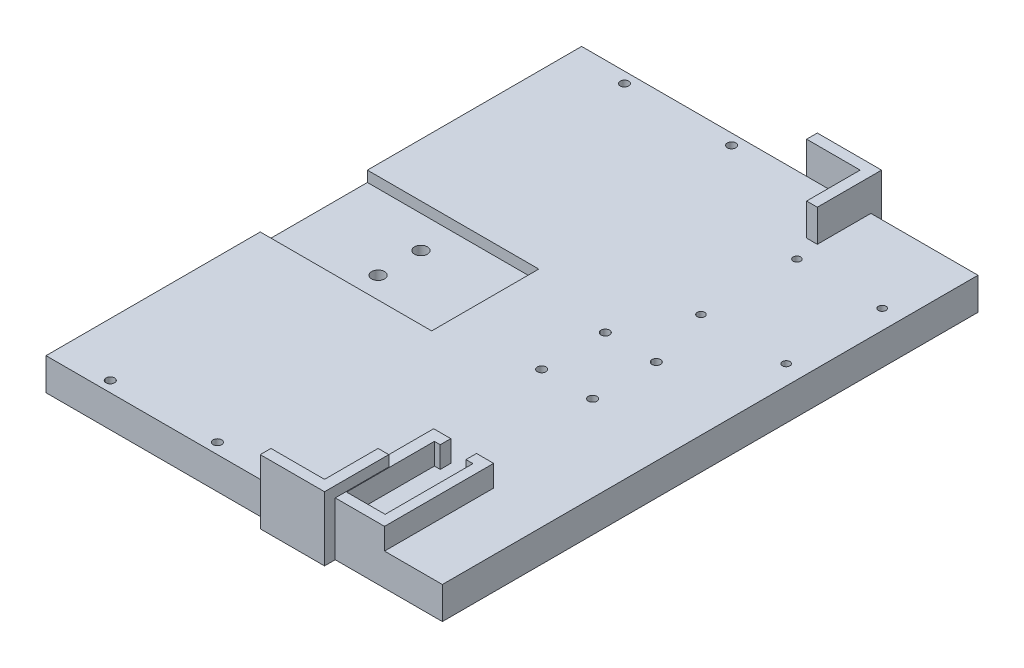
from build123d import *
from OCP.BRepFilletAPI import BRepFilletAPI_MakeChamfer

# Parameters (mm, degrees)
AUFSATZ_LINEAR_AUSTRAGEN1_DEPTH      = 15
SKIZZE2_W                            = 5
SKIZZE2_H                            = 4
SKIZZE2_H_2                          = 3
AUFSATZ_LINEAR_AUSTRAGEN2_DEPTH      = 37
AUFSATZ_LINEAR_AUSTRAGEN3_DEPTH      = 15
SKIZZE4_W                            = 5
SKIZZE4_H                            = 250
AUFSATZ_LINEAR_AUSTRAGEN4_DEPTH      = 15
SKIZZE5_W                            = 30
SKIZZE5_H                            = 5
AUFSATZ_LINEAR_AUSTRAGEN5_DEPTH      = 30
AUFSATZ_LINEAR_AUSTRAGEN6_DEPTH      = 15
AUFSATZ_LINEAR_AUSTRAGEN6_2_DEPTH    = 15
SKIZZE7_W                            = 5
SKIZZE7_H                            = 5
AUFSATZ_LINEAR_AUSTRAGEN7_DEPTH      = 15
AUFSATZ_LINEAR_AUSTRAGEN8_DEPTH      = 15
AUFSATZ_LINEAR_AUSTRAGEN8_DEPTH_BACK = 15
SKIZZE8_W                            = 5
SKIZZE8_H                            = 30.74644599
SKIZZE8_H_2                          = 29.008771532
SKIZZE9_W                            = 5
SKIZZE9_H                            = 5
AUFSATZ_LINEAR_AUSTRAGEN10_DEPTH     = 15
SKIZZE10_W                           = 5
SKIZZE10_H                           = 30
SCHNITT_LINEAR_AUSTRAGEN1_DEPTH      = 1.01
SKIZZE12_W                           = 10.711230156
SKIZZE12_H                           = 5
SKIZZE12_W_2                         = 5
SKIZZE12_H_2                         = 5.74644599
SKIZZE12_H_3                         = 4.008771532
SKIZZE12_W_3                         = 18.406645612
SKIZZE12_H_4                         = 11.130363441
SKIZZE12_W_4                         = 9.588104439
SKIZZE12_H_5                         = 13.193622238
SCHNITT_LINEAR_AUSTRAGEN2_DEPTH      = 15
SKIZZE13_W                           = 10.711230156
SKIZZE13_H                           = 5
SKIZZE13_W_2                         = 9.588104439
SKIZZE13_W_3                         = 5
SKIZZE13_H_2                         = 13.193622238
SKIZZE13_H_3                         = 11.130363441
SKIZZE13_W_4                         = 18.406645612
SCHNITT_LINEAR_AUSTRAGEN3_DEPTH      = 15
SKIZZE14_W                           = 50
SKIZZE14_H                           = 50
SKIZZE14_W_2                         = 20
AUFSATZ_LINEAR_AUSTRAGEN11_DEPTH     = 20
FASE2_SIZE                           = 20
FASE2_SIZE2                          = 50
FASE3_SIZE                           = 20
FASE3_SIZE2                          = 35
FASE4_SIZE                           = 20
SKIZZE15_R                           = 10
SKIZZE15_R_2                         = 7.5
AUFSATZ_LINEAR_AUSTRAGEN12_DEPTH     = 3
VERRUNDUNG1_R                        = 10
SKIZZE18_R                           = 10
SKIZZE18_R_2                         = 7.5
AUFSATZ_LINEAR_AUSTRAGEN13_DEPTH     = 3
VERRUNDUNG2_R                        = 10
SKIZZE19_R                           = 10
AUFSATZ_LINEAR_AUSTRAGEN14_DEPTH     = 3
VERRUNDUNG3_R                        = 10
SKIZZE20_R                           = 1.5
SCHNITT_LINEAR_AUSTRAGEN4_DEPTH      = 250
SKIZZE21_W                           = 4
SKIZZE21_H                           = 7
SKIZZE21_H_2                         = 5.2
SKIZZE21_W_2                         = 41
AUFSATZ_LINEAR_AUSTRAGEN15_DEPTH     = 10
SKIZZE22_R                           = 1.75
SCHNITT_LINEAR_AUSTRAGEN5_DEPTH      = 20
SCHNITT_LINEAR_AUSTRAGEN6_DEPTH      = 59
SCHNITT_LINEAR_AUSTRAGEN6_DEPTH_BACK = 47
SKIZZE23_W                           = 190
SKIZZE23_H                           = 302.641157469
SKIZZE24_W                           = 50
SKIZZE24_H                           = 5
SCHNITT_LINEAR_AUSTRAGEN7_DEPTH      = 80
SKIZZE25_R                           = 12.5
SCHNITT_LINEAR_AUSTRAGEN8_DEPTH      = 80
SKIZZE26_R                           = 17.590862423
AUFSATZ_LINEAR_AUSTRAGEN16_DEPTH     = 10
SKIZZE27_R                           = 3
SCHNITT_LINEAR_AUSTRAGEN10_DEPTH     = 93
SKIZZE28_R                           = 2
SCHNITT_LINEAR_AUSTRAGEN11_DEPTH     = 93
SKIZZE29_R                           = 2
SCHNITT_LINEAR_AUSTRAGEN13_DEPTH     = 20
SKIZZE30_W                           = 80
SKIZZE30_H                           = 50
AUFSATZ_LINEAR_AUSTRAGEN17_DEPTH     = 7
SKIZZE31_R                           = 3
SCHNITT_LINEAR_AUSTRAGEN14_DEPTH     = 27
AUFSATZ_LINEAR_START                 = -9
SKIZZE32_R                           = 3
SKIZZE32_R_2                         = 3.723627145
SKIZZE32_R_3                         = 5.253378479
SKIZZE32_R_4                         = 5.58705402
AUFSATZ_LINEAR_AUSTRAGEN18_DEPTH     = 9
SKIZZE35_R                           = 1.75
SCHNITT_LINEAR_AUSTRAGEN16_DEPTH     = 20
SKIZZE36_R                           = 6.846616126
SKIZZE36_R_2                         = 4.471320942
SKIZZE36_R_3                         = 4.89424988
SKIZZE36_R_4                         = 3.525123697
AUFSATZ_LINEAR_AUSTRAGEN19_DEPTH     = 15
SKIZZE39_W                           = 50
SKIZZE39_H                           = 250
SCHNITT_LINEAR_AUSTRAGEN17_DEPTH     = 57
SKIZZE40_W                           = 11.456450468
SKIZZE40_H                           = 117.894868185
SCHNITT_LINEAR_AUSTRAGEN18_DEPTH     = 86
SKIZZE41_W                           = 5.359084078
SKIZZE41_H                           = 0.710531035
SCHNITT_LINEAR_AUSTRAGEN19_DEPTH     = 69
AUFSATZ_LINEAR_AUSTRAGEN20_DEPTH     = 10


with BuildPart() as part:
    # Skizze1 → Aufsatz-Linear austragen1 (new body)
    with BuildSketch(Plane(origin=(0, 0, 0), x_dir=(1, 0, 0), z_dir=(0, 1, 0))):
        Polygon((-105, 65), (-175, 65), (-175, -65), (-105, -65), (-105, -125), (145, -125), (185, -20), (175, -20), (175, 0), (175, 20), (185, 20), (145, 125), (-105, 125), align=None)
        Polygon((175, 0), (175, 20), (185, 20), (185, 0), (185, -20), (175, -20), align=None)
    extrude(amount=AUFSATZ_LINEAR_AUSTRAGEN1_DEPTH)

    # Skizze2 → Aufsatz-Linear austragen2 (add)
    with BuildSketch(Plane(origin=(0, 15, 0), x_dir=(1, 0, 0), z_dir=(0, 1, 0))):
        with Locations((-122.5, -40)):
            Rectangle(SKIZZE2_W, SKIZZE2_H)
        with Locations((-122.5, 40)):
            Rectangle(SKIZZE2_W, SKIZZE2_H)
        with Locations((-122.5, 63.5)):
            Rectangle(SKIZZE2_W, SKIZZE2_H_2)
        with Locations((-122.5, -63.5)):
            Rectangle(SKIZZE2_W, SKIZZE2_H_2)
    extrude(amount=-AUFSATZ_LINEAR_AUSTRAGEN2_DEPTH)

    # Skizze3 → Aufsatz-Linear austragen3 (add)
    with BuildSketch(Plane(origin=(0, 15, 0), x_dir=(1, 0, 0), z_dir=(0, 1, 0))):
        Polygon((145, -125), (195, -125), (195, 125), (145, 125), (185, 20), (185, -20), align=None)
    extrude(amount=-AUFSATZ_LINEAR_AUSTRAGEN3_DEPTH)

    # Skizze4 → Aufsatz-Linear austragen4 (add)
    with BuildSketch(Plane(origin=(0, 15, 0), x_dir=(1, 0, 0), z_dir=(0, 1, 0))):
        with Locations((197.5, 0)):
            Rectangle(SKIZZE4_W, SKIZZE4_H)
    extrude(amount=-AUFSATZ_LINEAR_AUSTRAGEN4_DEPTH)

    # Skizze5 → Aufsatz-Linear austragen5 (add)
    with BuildSketch(Plane(origin=(0, 15, 0), x_dir=(1, 0, 0), z_dir=(0, 1, 0))):
        with Locations((-90, 122.5)):
            Rectangle(SKIZZE5_W, SKIZZE5_H)
        with Locations((-90, -122.5)):
            Rectangle(SKIZZE5_W, SKIZZE5_H)
    extrude(amount=-AUFSATZ_LINEAR_AUSTRAGEN5_DEPTH)



with BuildPart() as body_2:
    # Skizze6 → Aufsatz-Linear austragen6 (new body)
    with BuildSketch(Plane(origin=(0, 15, 0), x_dir=(1, 0, 0), z_dir=(0, 1, 0))):
        Polygon((-61.593354388, 130), (-110, 130), (-110, 88.869636559), (-105, 88.869636559), (-105, 125), (-61.593354388, 125), align=None)
    extrude(amount=AUFSATZ_LINEAR_AUSTRAGEN6_DEPTH)


with BuildPart() as body_3:
    # Skizze6 → Aufsatz-Linear austragen6 2 (new body)
    with BuildSketch(Plane(origin=(0, 15, 0), x_dir=(1, 0, 0), z_dir=(0, 1, 0))):
        Polygon((-110, -86.806377762), (-110, -130), (-70.411895561, -130), (-70.411895561, -125), (-105, -125), (-105, -86.806377762), align=None)
    extrude(amount=AUFSATZ_LINEAR_AUSTRAGEN6_2_DEPTH)


with BuildPart() as part_1:
    add(part.part)

    add(body_2.part)  # Aufsatz-Linear austragen7 merges body 2

    add(body_3.part)  # Aufsatz-Linear austragen7 merges body 3
    # Skizze7 → Aufsatz-Linear austragen7 (add)
    with BuildSketch(Plane.XZ):
        Polygon((-110, -88.869636559), (-110, -125), (-105, -125), (-105, -120), (-105, -88.869636559), align=None)
        with Locations((-107.5, -127.5)):
            Rectangle(SKIZZE7_W, SKIZZE7_H)
        Polygon((-105, -125), (-105, -130), (-61.593354388, -130), (-61.593354388, -125), (-75, -125), align=None)
        Polygon((-105, 125), (-110, 125), (-110, 86.806377762), (-105, 86.806377762), (-105, 120), align=None)
        with Locations((-107.5, 127.5)):
            Rectangle(SKIZZE7_W, SKIZZE7_H)
        Polygon((-70.411895561, 130), (-105, 130), (-105, 125), (-75, 125), (-70.411895561, 125), align=None)
    extrude(amount=-AUFSATZ_LINEAR_AUSTRAGEN7_DEPTH)

    # Skizze8 → Aufsatz-Linear austragen8 (add, two sides: drawn at the far end of the back side and taken through both)
    with BuildSketch(Plane(origin=(0, 15, 0), x_dir=(1, 0, 0), z_dir=(0, 1, 0)).offset(-AUFSATZ_LINEAR_AUSTRAGEN8_DEPTH_BACK)):
        with Locations((147.5, -109.626777005)):
            Rectangle(SKIZZE8_W, SKIZZE8_H)
        Polygon((145, -125), (109.288769844, -125), (109.288769844, -130), (150, -130), (150, -125), align=None)
        with Locations((147.5, 110.495614234)):
            Rectangle(SKIZZE8_W, SKIZZE8_H_2)
        Polygon((118.994620346, 130), (118.994620346, 125), (145, 125), (150, 125), (150, 130), align=None)
    extrude(amount=AUFSATZ_LINEAR_AUSTRAGEN8_DEPTH + AUFSATZ_LINEAR_AUSTRAGEN8_DEPTH_BACK)

    # Skizze9 → Aufsatz-Linear austragen10 (add)
    with BuildSketch(Plane(origin=(0, 15, 0), x_dir=(1, 0, 0), z_dir=(0, 1, 0))):
        Polygon((145, 4), (150, 4), (150, 9), (150, 14), (145, 14), align=None)
        with Locations((152.5, 6.5)):
            Rectangle(SKIZZE9_W, SKIZZE9_H)
        Polygon((190, 4), (200, 4), (200, 14), (196, 14), (196, 9), (190, 9), align=None)
        Polygon((196, 105), (200, 105), (200, 125), (150, 125), (150, 120), (196, 120), align=None)
    extrude(amount=AUFSATZ_LINEAR_AUSTRAGEN10_DEPTH)

    # Skizze10 → Schnitt-Linear austragen1 (cut)
    with BuildSketch(Plane.ZY.offset(-118.994620346)):
        with Locations((-127.5, 15)):
            Rectangle(SKIZZE10_W, SKIZZE10_H)
    extrude(amount=-SCHNITT_LINEAR_AUSTRAGEN1_DEPTH, mode=Mode.SUBTRACT)

    # Skizze12 → Schnitt-Linear austragen2 (cut)
    with BuildSketch(Plane(origin=(0, 15, 0), x_dir=(1, 0, 0), z_dir=(0, 1, 0))):
        with Locations((114.644384922, -127.5)):
            Rectangle(SKIZZE12_W, SKIZZE12_H)
        with Locations((147.5, -97.126777005)):
            Rectangle(SKIZZE12_W_2, SKIZZE12_H_2)
        with Locations((147.5, 97.995614234)):
            Rectangle(SKIZZE12_W_2, SKIZZE12_H_3)
        with Locations((-70.796677194, 127.5)):
            Rectangle(SKIZZE12_W_3, SKIZZE12_H)
        with Locations((-107.5, 94.43481828)):
            Rectangle(SKIZZE12_W_2, SKIZZE12_H_4)
        with Locations((-75.20594778, -127.5)):
            Rectangle(SKIZZE12_W_4, SKIZZE12_H)
        with Locations((-107.5, -93.403188881)):
            Rectangle(SKIZZE12_W_2, SKIZZE12_H_5)
    extrude(amount=SCHNITT_LINEAR_AUSTRAGEN2_DEPTH, mode=Mode.SUBTRACT)

    # Skizze13 → Schnitt-Linear austragen3 (cut)
    with BuildSketch(Plane(origin=(0, 15, 0), x_dir=(1, 0, 0), z_dir=(0, 1, 0))):
        with Locations((114.644384922, -127.5)):
            Rectangle(SKIZZE13_W, SKIZZE13_H)
        with Locations((-75.20594778, -127.5)):
            Rectangle(SKIZZE13_W_2, SKIZZE13_H)
        with Locations((-107.5, -93.403188881)):
            Rectangle(SKIZZE13_W_3, SKIZZE13_H_2)
        with Locations((-107.5, 94.43481828)):
            Rectangle(SKIZZE13_W_3, SKIZZE13_H_3)
        with Locations((-70.796677194, 127.5)):
            Rectangle(SKIZZE13_W_4, SKIZZE13_H)
    extrude(amount=-SCHNITT_LINEAR_AUSTRAGEN3_DEPTH, mode=Mode.SUBTRACT)

    # Skizze14 → Aufsatz-Linear austragen11 (add)
    with BuildSketch(Plane(origin=(0, 15, 0), x_dir=(1, 0, 0), z_dir=(0, 1, 0))):
        Polygon((-175, -25), (-175, -65), (-105, -65), (-105, -25), (-125, -25), align=None)
        with Locations((-150, 0)):
            Rectangle(SKIZZE14_W, SKIZZE14_H)
        with Locations((-115, 0)):
            Rectangle(SKIZZE14_W_2, SKIZZE14_H)
        Polygon((-175, 65), (-175, 25), (-125, 25), (-105, 25), (-105, 65), align=None)
    extrude(amount=AUFSATZ_LINEAR_AUSTRAGEN11_DEPTH)

    # Fase2
    fase2_edges = [part_1.edges().sort_by_distance(p)[0] for p in [
        (-175, 35, 0),
    ]]
    fase2_side = [part_1.faces().sort_by_distance(p)[0] for p in [
        (-175, 17.5, 0),
    ]]
    chamfer(fase2_edges, length=FASE2_SIZE, length2=FASE2_SIZE2, reference=fase2_side[0])

    # Fase3: one chamfer whose edges measure the first distance from different faces: ONE call of the kernel's chamfer builder (chamfer() names one face for all edges)
    fase3_edges_1 = [part_1.edges().sort_by_distance(p)[0] for p in [
        (-115, 35, -65),
    ]]
    fase3_side_1 = [part_1.faces().sort_by_distance(p)[0] for p in [
        (-134.615695793, 13.348705502, -65),
    ]]
    fase3_edges_2 = [part_1.edges().sort_by_distance(p)[0] for p in [
        (-115, 35, 65),
    ]]
    fase3_side_2 = [part_1.faces().sort_by_distance(p)[0] for p in [
        (-134.615695793, 13.348705502, 65),
    ]]
    fase3 = BRepFilletAPI_MakeChamfer(part_1.part.solid().wrapped)
    for e in fase3_edges_1:
        fase3.Add(FASE3_SIZE, FASE3_SIZE2, e.wrapped, fase3_side_1[0].wrapped)  # the first distance lies on this face
    for e in fase3_edges_2:
        fase3.Add(FASE3_SIZE, FASE3_SIZE2, e.wrapped, fase3_side_2[0].wrapped)  # the first distance lies on this face
    add(Compound.cast(fase3.Shape()), mode=Mode.REPLACE)

    # Fase4
    fase4_edges = [part_1.edges().sort_by_distance(p)[0] for p in [
        (-150, 25, 47.5),
        (-150, 25, -47.5),
    ]]
    chamfer(fase4_edges, length=FASE4_SIZE)

    # Skizze15 → Aufsatz-Linear austragen12 (add)
    with BuildSketch(Plane(origin=(-11.551963806, 55.886277719, -15.432210402), x_dir=(0.9807222582245502, 0.18835756766165584, -0.05201229592628623), z_dir=(-0.19540688888301463, 0.9453426139004438, -0.2610430809673718))):
        with Locations(Location((-117.284914164, 20.601047932, 0), (0, 0, 270))):
            Circle(SKIZZE15_R)
        with Locations(Location((-142.839757147, 36.315690789, 0), (0, 0, 270))):
            Circle(SKIZZE15_R_2)
    extrude(amount=AUFSATZ_LINEAR_AUSTRAGEN12_DEPTH)

    # Verrundung1
    # the kernel refuses this fillet: 10 mm, written as the material it takes off along each edge
    with BuildSketch(Plane(origin=(-127.162110348, 31.147334465, -29.972945243), x_dir=(0, 0.26617432079083353, 0.963924909394678), z_dir=(-0.9807222582245501, -0.18835756766165582, 0.052012295926286305))) as verrundung1_piece_1:
        with BuildLine():
            CenterArc((2.858571571, -10), VERRUNDUNG1_R, 44.427004001, 45.572995999)
            Line((2.858571571, 0), (2.858571571, 0.2))
            Line((2.858571571, 0.2), (10, 0.2))
            Line((10, 0.2), (10.2, 0))
            ThreePointArc((10.2, 0), (10.2, -1.5), (10.142828569, -2.86))
            Line((10.142828569, -2.86), (10, -3))
        make_face()
    revolve(axis=Axis((-127.162110348, 31.147334465, -29.972945243), (-0.19540688888301466, 0.9453426139004438, -0.2610430809673718)), mode=Mode.SUBTRACT)
    with BuildSketch(Plane(origin=(-152.224313666, 22.15105201, -43.791514879), x_dir=(0, 0.26617432079083364, 0.9639249093946781), z_dir=(-0.9807222582245503, -0.18835756766165584, 0.052012295926286325))) as verrundung1_piece_2:
        with BuildLine():
            CenterArc((0.358571571, -10), VERRUNDUNG1_R, 44.427004001, 45.572995999)
            Line((0.358571571, 0), (0.358571571, 0.2))
            Line((0.358571571, 0.2), (7.5, 0.2))
            Line((7.5, 0.2), (7.7, 0))
            ThreePointArc((7.7, 0), (7.7, -1.5), (7.642828569, -2.86))
            Line((7.642828569, -2.86), (7.5, -3))
        make_face()
    revolve(axis=Axis((-152.224313666, 22.15105201, -43.791514879), (-0.19540688888301466, 0.9453426139004438, -0.2610430809673718)), mode=Mode.SUBTRACT)

    # Skizze18 → Aufsatz-Linear austragen13 (add)
    with BuildSketch(Plane(origin=(-11.551963806, 55.886277719, 15.432210402), x_dir=(0.9807222582245502, 0.18835756766165587, 0.05201229592628629), z_dir=(-0.19540688888301466, 0.9453426139004437, 0.261043080967372))):
        with Locations(Location((-117.284914164, -25.97894302, 0), (0, 0, 270))):
            Circle(SKIZZE18_R)
        with Locations(Location((-147.284914164, -39.72137923, 0), (0, 0, 270))):
            Circle(SKIZZE18_R_2)
    extrude(amount=AUFSATZ_LINEAR_AUSTRAGEN13_DEPTH)

    # Verrundung2
    # the kernel refuses this fillet: 10 mm, written as the material it takes off along each edge
    with BuildSketch(Plane(origin=(-127.162110348, 29.715876892, 35.156832279), x_dir=(0, -0.26617432079083353, 0.963924909394678), z_dir=(-0.98072225822455, -0.1883575676616558, -0.0520122959262863))) as verrundung2_piece_1:
        with BuildLine():
            CenterArc((2.858571571, -10), VERRUNDUNG2_R, 44.427004001, 45.572995999)
            Line((2.858571571, 0), (2.858571571, 0.2))
            Line((2.858571571, 0.2), (10, 0.2))
            Line((10, 0.2), (10.2, 0))
            ThreePointArc((10.2, 0), (10.2, -1.5), (10.142828569, -2.86))
            Line((10.142828569, -2.86), (10, -3))
        make_face()
    revolve(axis=Axis((-127.162110348, 29.715876892, 35.156832279), (-0.19540688888301463, 0.9453426139004436, 0.26104308096737205)), mode=Mode.SUBTRACT)
    with BuildSketch(Plane(origin=(-156.583778094, 20.407266239, 46.843139979), x_dir=(0, -0.26617432079083425, 0.9639249093946779), z_dir=(-0.9807222582245501, -0.18835756766165576, -0.05201229592628644))) as verrundung2_piece_2:
        with BuildLine():
            CenterArc((0.358571571, -10), VERRUNDUNG2_R, 44.427004001, 45.572995999)
            Line((0.358571571, 0), (0.358571571, 0.2))
            Line((0.358571571, 0.2), (7.5, 0.2))
            Line((7.5, 0.2), (7.7, 0))
            ThreePointArc((7.7, 0), (7.7, -1.5), (7.642828569, -2.86))
            Line((7.642828569, -2.86), (7.5, -3))
        make_face()
    revolve(axis=Axis((-156.583778094, 20.407266239, 46.843139979), (-0.19540688888301463, 0.9453426139004436, 0.26104308096737205)), mode=Mode.SUBTRACT)

    # Skizze19 → Aufsatz-Linear austragen14 (add)
    with BuildSketch(Plane(origin=(-29.310344828, 73.275862069, 0), x_dir=(0.9284766908852605, 0.371390676354101, 0), z_dir=(-0.371390676354101, 0.9284766908852605, 0))):
        with Locations(Location((-118.060912688, -0.063197478, 0), (0, 0, 180))):
            Circle(SKIZZE19_R)
        with Locations(Location((-139.860763151, 12.174715734, 0), (0, 0, 180))):
            Circle(SKIZZE19_R)
        with Locations(Location((-139.91256076, -12.208380744, 0), (0, 0, 180))):
            Circle(SKIZZE19_R)
    extrude(amount=AUFSATZ_LINEAR_AUSTRAGEN14_DEPTH)

    # Verrundung3
    # the kernel refuses this fillet: 10 mm, written as the material it takes off along each edge
    with BuildSketch(Plane(origin=(-140.041322392, 32.214569927, 0.063197478), x_dir=(-0.9284766908852606, -0.37139067635410067, 0), z_dir=(0, 0, -1))) as verrundung3_piece_1:
        with BuildLine():
            CenterArc((2.858571571, -10), VERRUNDUNG3_R, 44.427004001, 45.572995999)
            Line((2.858571571, 0), (2.858571571, 0.2))
            Line((2.858571571, 0.2), (10, 0.2))
            Line((10, 0.2), (10.2, 0))
            ThreePointArc((10.2, 0), (10.2, -1.5), (10.142828569, -2.86))
            Line((10.142828569, -2.86), (10, -3))
        make_face()
    revolve(axis=Axis((-140.041322392, 32.214569927, 0.063197478), (-0.371390676354101, 0.9284766908852605, 0)), mode=Mode.SUBTRACT)
    with BuildSketch(Plane(origin=(-160.281975412, 24.11830872, -12.174715734), x_dir=(-0.9284766908852602, -0.37139067635410167, 0), z_dir=(0, 0, -1))) as verrundung3_piece_2:
        with BuildLine():
            CenterArc((2.858571571, -10), VERRUNDUNG3_R, 44.427004001, 45.572995999)
            Line((2.858571571, 0), (2.858571571, 0.2))
            Line((2.858571571, 0.2), (10, 0.2))
            Line((10, 0.2), (10.2, 0))
            ThreePointArc((10.2, 0), (10.2, -1.5), (10.142828569, -2.86))
            Line((10.142828569, -2.86), (10, -3))
        make_face()
    revolve(axis=Axis((-160.281975412, 24.11830872, -12.174715734), (-0.371390676354101, 0.9284766908852605, 0)), mode=Mode.SUBTRACT)
    with BuildSketch(Plane(origin=(-160.330068284, 24.099071571, 12.208380744), x_dir=(-0.9284766908852602, -0.37139067635410167, 0), z_dir=(0, 0, -1))) as verrundung3_piece_3:
        with BuildLine():
            CenterArc((2.858571571, -10), VERRUNDUNG3_R, 44.427004001, 45.572995999)
            Line((2.858571571, 0), (2.858571571, 0.2))
            Line((2.858571571, 0.2), (10, 0.2))
            Line((10, 0.2), (10.2, 0))
            ThreePointArc((10.2, 0), (10.2, -1.5), (10.142828569, -2.86))
            Line((10.142828569, -2.86), (10, -3))
        make_face()
    revolve(axis=Axis((-160.330068284, 24.099071571, 12.208380744), (-0.371390676354101, 0.9284766908852605, 0)), mode=Mode.SUBTRACT)

    # Skizze20 → Schnitt-Linear austragen4 (cut)
    with BuildSketch(Plane(origin=(0, 0, -65), x_dir=(-1, 0, 0), z_dir=(0, 0, -1))):
        with Locations(Location((122.5, -19.5, 0), (0, 0, 180))):
            Circle(SKIZZE20_R)
        with Locations(Location((122.5, -2.5, 0), (0, 0, 180))):
            Circle(SKIZZE20_R)
    extrude(amount=-SCHNITT_LINEAR_AUSTRAGEN4_DEPTH, mode=Mode.SUBTRACT)

    # Skizze21 → Aufsatz-Linear austragen15 (add)
    with BuildSketch(Plane(origin=(0, 15, 0), x_dir=(1, 0, 0), z_dir=(0, 1, 0))):
        Polygon((145, -100), (150, -100), (191, -100), (191, -93), (145, -93), align=None)
        with Locations((193, -96.5)):
            Rectangle(SKIZZE21_W, SKIZZE21_H)
        with Locations((193, -102.6)):
            Rectangle(SKIZZE21_W, SKIZZE21_H_2)
        with Locations((170.5, -121.5)):
            Rectangle(SKIZZE21_W_2, SKIZZE21_H)
        with Locations((193, -121.5)):
            Rectangle(SKIZZE21_W, SKIZZE21_H)
        with Locations((193, -115.4)):
            Rectangle(SKIZZE21_W, SKIZZE21_H_2)
    extrude(amount=AUFSATZ_LINEAR_AUSTRAGEN15_DEPTH)

    # Skizze22 → Schnitt-Linear austragen5 (cut)
    with BuildSketch(Plane(origin=(0, 15, 0), x_dir=(1, 0, 0), z_dir=(0, 1, 0))):
        with Locations(Location((146.069548912, -58.232980191, 0), (0, 0, 270))):
            Circle(SKIZZE22_R)
        with Locations(Location((146.069548912, -13.432980191, 0), (0, 0, 270))):
            Circle(SKIZZE22_R)
        with Locations(Location((185.869548912, -58.232980191, 0), (0, 0, 270))):
            Circle(SKIZZE22_R)
        with Locations(Location((185.869548912, -13.432980191, 0), (0, 0, 270))):
            Circle(SKIZZE22_R)
    extrude(amount=-SCHNITT_LINEAR_AUSTRAGEN5_DEPTH, mode=Mode.SUBTRACT)

    # Skizze23 → Schnitt-Linear austragen6 (cut, two sides: drawn at the far end of the back side and taken through both)
    with BuildSketch(Plane(origin=(0, 15, 0), x_dir=(1, 0, 0), z_dir=(0, 1, 0)).offset(-SCHNITT_LINEAR_AUSTRAGEN6_DEPTH_BACK)):
        with Locations((-80, -1.728280721)):
            Rectangle(SKIZZE23_W, SKIZZE23_H)
    extrude(amount=SCHNITT_LINEAR_AUSTRAGEN6_DEPTH + SCHNITT_LINEAR_AUSTRAGEN6_DEPTH_BACK, mode=Mode.SUBTRACT)

    # Skizze24 → Schnitt-Linear austragen7 (cut)
    with BuildSketch(Plane.ZY.offset(-15)):
        with Locations((0, 12.5)):
            Rectangle(SKIZZE24_W, SKIZZE24_H)
    extrude(amount=-SCHNITT_LINEAR_AUSTRAGEN7_DEPTH, mode=Mode.SUBTRACT)

    # Skizze25 → Schnitt-Linear austragen8 (cut)
    with BuildSketch(Plane(origin=(0, 10, 0), x_dir=(1, 0, 0), z_dir=(0, 1, 0))):
        with Locations(Location((65, 0, 0), (0, 0, 270))):
            Circle(SKIZZE25_R)
    extrude(amount=-SCHNITT_LINEAR_AUSTRAGEN8_DEPTH, mode=Mode.SUBTRACT)

    # Skizze26 → Aufsatz-Linear austragen16 (add)
    with BuildSketch(Plane.XZ):
        with Locations((65, 0)):
            Circle(SKIZZE26_R)
    extrude(amount=-AUFSATZ_LINEAR_AUSTRAGEN16_DEPTH)

    # Skizze27 → Schnitt-Linear austragen10 (cut)
    with BuildSketch(Plane(origin=(0, 15, 0), x_dir=(1, 0, 0), z_dir=(0, 1, 0))):
        with Locations(Location((75, 10, 0), (0, 0, 270))):
            Circle(SKIZZE27_R)
        with Locations(Location((75, -10, 0), (0, 0, 270))):
            Circle(SKIZZE27_R)
        with Locations(Location((35, 10, 0), (0, 0, 270))):
            Circle(SKIZZE27_R)
        with Locations(Location((35, -10, 0), (0, 0, 270))):
            Circle(SKIZZE27_R)
    extrude(amount=-SCHNITT_LINEAR_AUSTRAGEN10_DEPTH, mode=Mode.SUBTRACT)

    # Skizze28 → Schnitt-Linear austragen11 (cut)
    with BuildSketch(Plane(origin=(0, 15, 0), x_dir=(1, 0, 0), z_dir=(0, 1, 0))):
        with Locations(Location((160, 14.85, 0), (0, 0, 270))):
            Circle(SKIZZE28_R)
        with Locations(Location((160, -14.85, 0), (0, 0, 270))):
            Circle(SKIZZE28_R)
        with Locations(Location((136.2, -14.85, 0), (0, 0, 270))):
            Circle(SKIZZE28_R)
        with Locations(Location((136.2, 14.85, 0), (0, 0, 270))):
            Circle(SKIZZE28_R)
    extrude(amount=-SCHNITT_LINEAR_AUSTRAGEN11_DEPTH, mode=Mode.SUBTRACT)

    # Skizze29 → Schnitt-Linear austragen13 (cut)
    with BuildSketch(Plane(origin=(0, 15, 0), x_dir=(1, 0, 0), z_dir=(0, 1, 0))):
        with Locations(Location((90, 120, 0), (0, 0, 270))):
            Circle(SKIZZE29_R)
        with Locations(Location((40, 120, 0), (0, 0, 270))):
            Circle(SKIZZE29_R)
        with Locations(Location((90, -120, 0), (0, 0, 270))):
            Circle(SKIZZE29_R)
        with Locations(Location((40, -120, 0), (0, 0, 270))):
            Circle(SKIZZE29_R)
    extrude(amount=-SCHNITT_LINEAR_AUSTRAGEN13_DEPTH, mode=Mode.SUBTRACT)

    # Skizze30 → Aufsatz-Linear austragen17 (add)
    with BuildSketch(Plane(origin=(0, 10, 0), x_dir=(1, 0, 0), z_dir=(0, 1, 0))):
        with Locations((55, 0)):
            Rectangle(SKIZZE30_W, SKIZZE30_H)
    extrude(amount=-AUFSATZ_LINEAR_AUSTRAGEN17_DEPTH)

    # Skizze31 → Schnitt-Linear austragen14 (cut)
    with BuildSketch(Plane(origin=(0, 10, 0), x_dir=(1, 0, 0), z_dir=(0, 1, 0))):
        with Locations(Location((55, 10, 0), (0, 0, 270))):
            Circle(SKIZZE31_R)
        with Locations(Location((55, -10, 0), (0, 0, 270))):
            Circle(SKIZZE31_R)
    extrude(amount=-SCHNITT_LINEAR_AUSTRAGEN14_DEPTH, mode=Mode.SUBTRACT)

    # Skizze32 → Aufsatz-Linear austragen18 (add)
    with BuildSketch(Plane.XZ.offset(AUFSATZ_LINEAR_START)):
        with Locations((75, -10)):
            Circle(SKIZZE32_R)
        with Locations((75, 10)):
            Circle(SKIZZE32_R_2)
        with Locations((35, 10)):
            Circle(SKIZZE32_R_3)
        with Locations((35, -10)):
            Circle(SKIZZE32_R_4)
    extrude(amount=AUFSATZ_LINEAR_AUSTRAGEN18_DEPTH)

    # Skizze35 → Schnitt-Linear austragen16 (cut)
    with BuildSketch(Plane(origin=(0, 15, 0), x_dir=(1, 0, 0), z_dir=(0, 1, 0))):
        with Locations(Location((151.210510648, 44.477580629, 0), (0, 0, 270))):
            Circle(SKIZZE35_R)
        with Locations(Location((191.010510648, 44.478487984, 0), (0, 0, 270))):
            Circle(SKIZZE35_R)
        with Locations(Location((151.210510648, 89.277580629, 0), (0, 0, 270))):
            Circle(SKIZZE35_R)
        with Locations(Location((191.010510648, 89.278487984, 0), (0, 0, 270))):
            Circle(SKIZZE35_R)
    extrude(amount=-SCHNITT_LINEAR_AUSTRAGEN16_DEPTH, mode=Mode.SUBTRACT)

    # Skizze36 → Aufsatz-Linear austragen19 (add)
    with BuildSketch(Plane(origin=(0, 15, 0), x_dir=(1, 0, 0), z_dir=(0, 1, 0))):
        with Locations((146.097099783, -61.909031942)):
            Circle(SKIZZE36_R)
        with Locations((186.685228416, -57.92608474)):
            Circle(SKIZZE36_R_2)
        with Locations((186.685228416, -12.786016446)):
            Circle(SKIZZE36_R_3)
        with Locations((146.097099783, -12.786016446)):
            Circle(SKIZZE36_R_4)
    extrude(amount=-AUFSATZ_LINEAR_AUSTRAGEN19_DEPTH)

    # Skizze39 → Schnitt-Linear austragen17 (cut)
    with BuildSketch(Plane(origin=(0, 15, 0), x_dir=(1, 0, 0), z_dir=(0, 1, 0))):
        with Locations((175, 0)):
            Rectangle(SKIZZE39_W, SKIZZE39_H)
    extrude(amount=SCHNITT_LINEAR_AUSTRAGEN17_DEPTH, mode=Mode.SUBTRACT)

    # Skizze40 → Schnitt-Linear austragen18 (cut)
    with BuildSketch(Plane(origin=(0, 15, 0), x_dir=(1, 0, 0), z_dir=(0, 1, 0))):
        with Locations((148.530078419, -40.830256609)):
            Rectangle(SKIZZE40_W, SKIZZE40_H)
    extrude(amount=SCHNITT_LINEAR_AUSTRAGEN18_DEPTH, mode=Mode.SUBTRACT)

    # Skizze41 → Schnitt-Linear austragen19 (cut)
    with BuildSketch(Plane(origin=(0, 15, 0), x_dir=(1, 0, 0), z_dir=(0, 1, 0))):
        with Locations((147.679542039, -99.644734483)):
            Rectangle(SKIZZE41_W, SKIZZE41_H)
    extrude(amount=SCHNITT_LINEAR_AUSTRAGEN19_DEPTH, mode=Mode.SUBTRACT)

    # Skizze42 → Aufsatz-Linear austragen20 (add)
    with BuildSketch(Plane(origin=(0, 15, 0), x_dir=(1, 0, 0), z_dir=(0, 1, 0))):
        Polygon((168.282600421, -120), (150.282600421, -120), (150.282600421, -79), (153, -79), (153, -74.066572639), (145, -74.066572639), (145, -100), (150, -100), (150, -125), (173, -125), (173, -74.066572639), (165, -74.066572639), (165, -79), (168.282600421, -79), align=None)
    extrude(amount=AUFSATZ_LINEAR_AUSTRAGEN20_DEPTH)


solid = part_1.part
